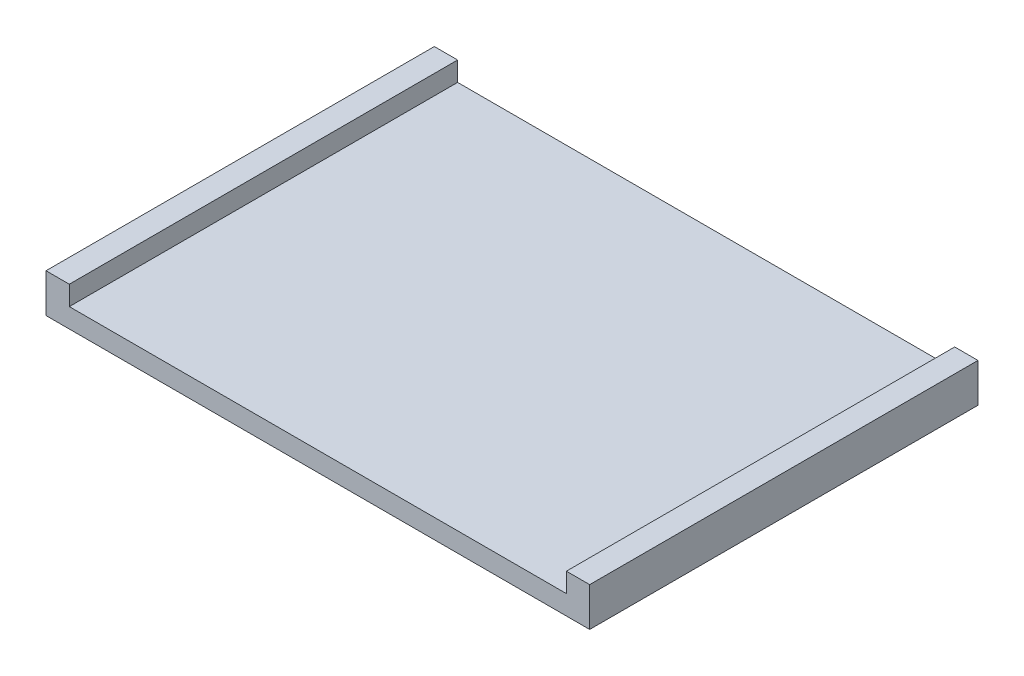
from build123d import *

# Parameters (mm, degrees)
SKETCH1_W           = 140
SKETCH1_H           = 100
BOSS_EXTRUDE1_DEPTH = 5
SKETCH2_W           = 6
SKETCH2_H           = 100
BOSS_EXTRUDE2_DEPTH = 5


with BuildPart() as part:
    # Sketch1 → Boss-Extrude1 (new body)
    with BuildSketch(Plane(origin=(0, 0, 0), x_dir=(1, 0, 0), z_dir=(0, 1, 0))):
        Rectangle(SKETCH1_W, SKETCH1_H)
    extrude(amount=BOSS_EXTRUDE1_DEPTH)

    # Sketch2 → Boss-Extrude2 (add)
    with BuildSketch(Plane(origin=(0, 5, 0), x_dir=(1, 0, 0), z_dir=(0, 1, 0))):
        with Locations((-67, 0)):
            Rectangle(SKETCH2_W, SKETCH2_H)
        with Locations((67, 0)):
            Rectangle(SKETCH2_W, SKETCH2_H)
    extrude(amount=BOSS_EXTRUDE2_DEPTH)


solid = part.part
